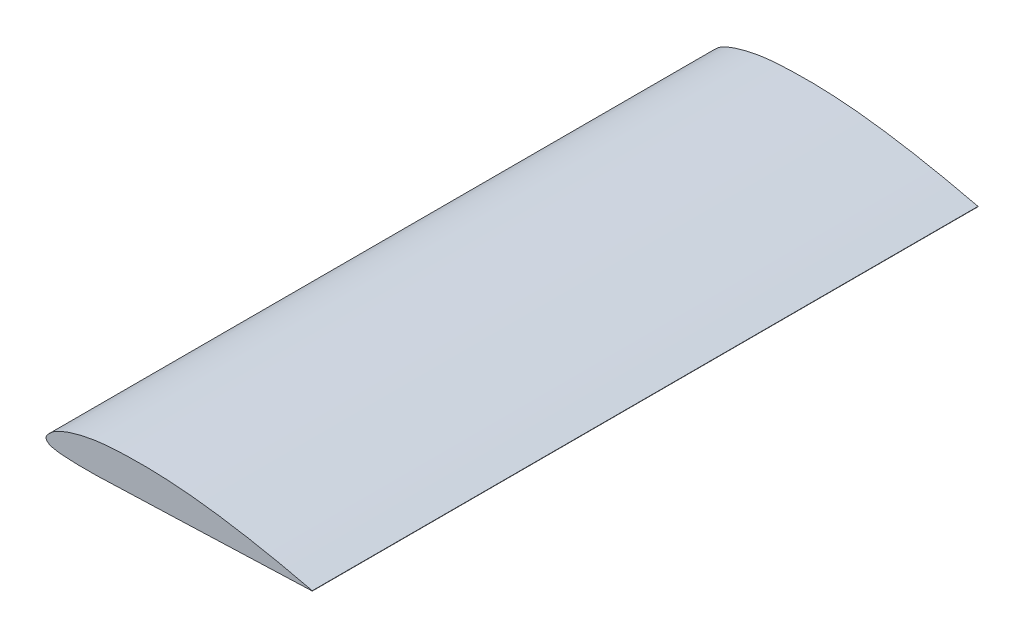
from build123d import *

# Parameters (mm, degrees)
BOSS_EXTRUDE1_DEPTH = 254


with BuildPart() as part:
    # Sketch1 → Boss-Extrude1 (new body)
    with BuildSketch(Plane.XY):
        with BuildLine():
            Line((101.6, 0.0608584), (101.6, -0.0608584))
            add(Edge.make_bspline(
                [(101.6, 0.0608584), (101.26134204, 0.141159168), (100.58407166, 0.301749906), (99.568107845, 0.541950998), (98.552207722, 0.781275199), (97.197951955, 1.097711547), (95.505215743, 1.487453751), (93.473140213, 1.943735428), (91.441031412, 2.389207324), (89.409054101, 2.824884088), (87.377052732, 3.25009609), (85.345088371, 3.664768981), (83.313044527, 4.068048066), (81.281091034, 4.460424481), (79.249033289, 4.840715624), (77.217053714, 5.209584503), (75.184989701, 5.566100096), (73.15299179, 5.910942013), (71.120966774, 6.243480472), (69.088991668, 6.56375313), (67.05706177, 6.870987878), (65.025062703, 7.163373785), (62.993106167, 7.440444886), (60.961082241, 7.700356266), (58.253012967, 8.022997082), (55.543439796, 8.309328721), (52.832794842, 8.55911463), (50.800724345, 8.728118086), (48.768678108, 8.878688228), (46.060083447, 9.053284368), (43.350465776, 9.184982074), (40.640311564, 9.267382784), (38.608139321, 9.302668529), (36.575994105, 9.313133714), (34.543885329, 9.300614855), (32.511802652, 9.267675627), (30.479753448, 9.215643726), (28.447524863, 9.148227983), (26.415094028, 9.056541401), (24.382399292, 8.930901823), (22.3493965, 8.760895741), (20.31599401, 8.536714236), (18.282888458, 8.246852681), (16.250074234, 7.890690371), (14.216696347, 7.470751283), (12.182071932, 6.982789152), (10.146442241, 6.41302793), (8.1111115, 5.743900189), (6.417003774, 5.104691219), (5.066831286, 4.503328747), (4.043629947, 3.979516328), (3.011221175, 3.357145601), (2.058123492, 2.630899909), (1.342346575, 1.941686602), (0.795976296, 1.387731075), (0.449009105, 0.982748459), (0.220848177, 0.634203658), (0.109243941, 0.405878898), (0.037952023, 0.209167733), (-0.026584623, -0.075047891), (0.006242954, -0.37079866), (0.109157223, -0.628233611), (0.21972451, -0.83294968), (0.444258502, -1.131378141), (0.786639612, -1.447660516), (1.320647561, -1.809102247), (2.078429018, -2.101874227), (3.045099744, -2.296634983), (4.060379866, -2.498523469), (5.077112316, -2.653690196), (6.431942614, -2.797345662), (8.127148124, -2.894765543), (10.1592925, -2.991299503), (12.191686539, -3.049317654), (14.223903322, -3.076828655), (16.256058805, -3.077665548), (18.288135103, -3.055954899), (20.997704169, -3.003175756), (23.706987001, -2.922649066), (26.41608068, -2.826829275), (28.448031461, -2.750600196), (30.479977341, -2.672634995), (32.511972338, -2.59621991), (34.543988354, -2.521428359), (36.575989587, -2.44712256), (38.608002715, -2.373518443), (40.640005691, -2.299669044), (42.672005334, -2.225490658), (44.704006374, -2.151045501), (46.735998964, -2.076167844), (48.76800274, -2.001458942), (50.799997549, -1.926506514), (52.831998347, -1.851750523), (54.863997868, -1.777061405), (58.250667665, -1.65282213), (61.637332245, -1.528474628), (65.701337201, -1.379393044), (68.410661747, -1.279653519), (71.120002979, -1.180334449), (73.151996929, -1.105561435), (75.184003096, -1.031087239), (77.215996897, -0.95631018), (79.248003105, -0.881837068), (81.279996895, -0.807059719), (83.312003105, -0.732586685), (85.343996895, -0.657809313), (87.376003105, -0.583336291), (89.407996894, -0.508558893), (91.440003108, -0.434085963), (93.471996884, -0.359308226), (95.504003145, -0.28483656), (97.197331354, -0.222517839), (98.552000201, -0.172827078), (99.567999698, -0.135526175), (100.584002251, -0.098274576), (101.261333669, -0.073330474), (101.6, -0.0608584)],
                knots=[0, 0, 0, 0, 0.005027835, 0.010054994, 0.01508103, 0.020105055, 0.030145261, 0.040173646, 0.050190794, 0.06019768, 0.070194226, 0.080180377, 0.09015591, 0.100121106, 0.110075703, 0.120020101, 0.129954271, 0.139878706, 0.149793491, 0.159698811, 0.169594433, 0.179479778, 0.189354744, 0.199219015, 0.209072795, 0.228751158, 0.238577242, 0.248395636, 0.258207018, 0.268011852, 0.287604023, 0.297393127, 0.307179253, 0.316964018, 0.326748819, 0.336534715, 0.346322474, 0.356112722, 0.365907652, 0.375711463, 0.385530879, 0.395375762, 0.405259305, 0.415192461, 0.425184025, 0.435248335, 0.445412191, 0.455710779, 0.466190959, 0.471552192, 0.477054504, 0.482786727, 0.488945835, 0.494316033, 0.497126416, 0.500187368, 0.502000869, 0.503128202, 0.503849971, 0.505020137, 0.507317905, 0.507986558, 0.509023586, 0.510668219, 0.513358348, 0.515715812, 0.519949385, 0.524973188, 0.5299544, 0.534903202, 0.539824123, 0.549630394, 0.559425369, 0.569214167, 0.578999733, 0.588784364, 0.598569511, 0.608355933, 0.627933315, 0.637723968, 0.6475154, 0.657307127, 0.667098669, 0.676889956, 0.686681117, 0.69647219, 0.70626328, 0.716054423, 0.72584562, 0.735636871, 0.745428122, 0.755219391, 0.765010642, 0.774801875, 0.78459309, 0.813966735, 0.82375795, 0.843340416, 0.853131631, 0.862922864, 0.872714079, 0.882505312, 0.892296527, 0.90208776, 0.911878975, 0.921670208, 0.931461423, 0.941252656, 0.951043871, 0.960835104, 0.970626319, 0.980417552, 0.98531316, 0.990208767, 0.995104375, 1, 1, 1, 1], degree=3))
        make_face()
    extrude(amount=BOSS_EXTRUDE1_DEPTH)


solid = part.part
